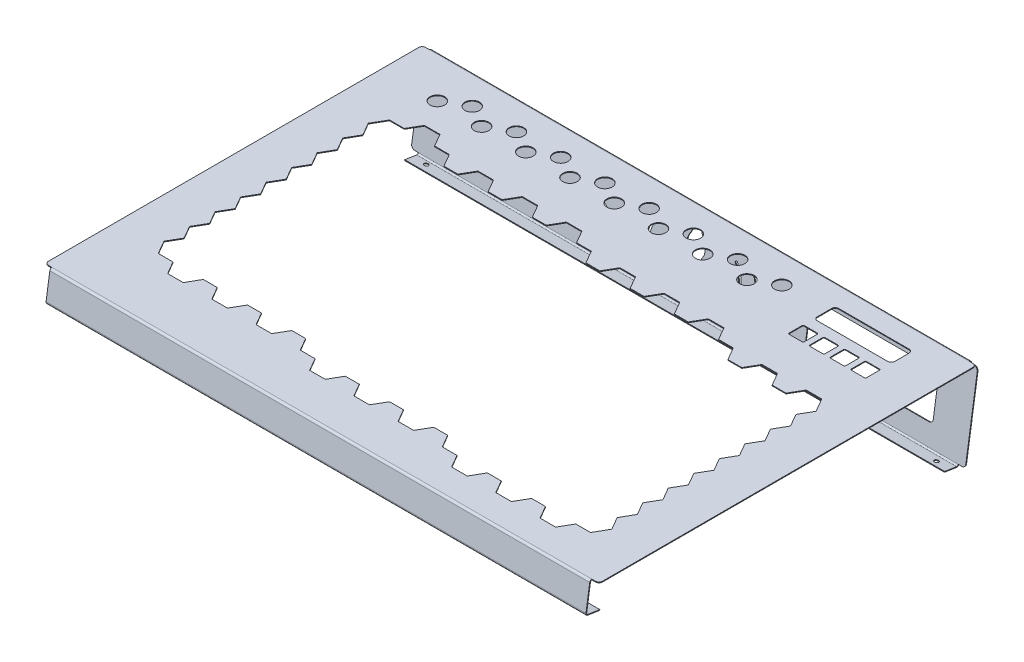
from build123d import *

# Parameters (mm, degrees)
SKETCH1_W                    = 481.838
SKETCH1_H                    = 340.0044
BASE_FLANGE1_DEPTH           = 0.6604
CUT_EXTRUDE1_DEPTH           = 388.714735506
EDGE_FLANGE1_START           = -330.2
EDGE_FLANGE1_DEPTH           = 481.838
EDGE_FLANGE1_2_DEPTH         = 481.838
EDGE_FLANGE2_STRIP_W         = 5.1816
EDGE_FLANGE2_STRIP_H         = 0.6604
EDGE_FLANGE2_STRIP_CUT_DEPTH = 481.838
EDGE_FLANGE2_DEPTH           = 481.838
EDGE_FLANGE3_STRIP_CUT_DEPTH = 481.838
EDGE_FLANGE3_DEPTH           = 481.838
CUT_EXTRUDE2_DEPTH           = 0.6604
EDGE_FLANGE4_STRIP_W         = 5.1816
EDGE_FLANGE4_STRIP_H         = 0.6604
EDGE_FLANGE4_STRIP_CUT_DEPTH = 481.838
EDGE_FLANGE4_DEPTH           = 481.838
SKETCH29_W                   = 6.35
SKETCH29_H                   = 336.766690974
TAB1_DEPTH                   = 0.6604
SKETCH31_W                   = 69.088
SKETCH31_H                   = 19.0754
CUT_EXTRUDE7_DEPTH           = 0.6604
CUT_EXTRUDE8_DEPTH           = 0.6604
SKETCH34_W                   = 6.35
SKETCH34_H                   = 73.450710069
TAB2_DEPTH                   = 0.6604
SKETCH35_W                   = 6.35
SKETCH35_H                   = 73.450710069
TAB3_DEPTH                   = 0.6604
SKETCH36_W                   = 6.35
SKETCH36_H                   = 336.766690974
TAB4_DEPTH                   = 0.6604
FILLET1_R                    = 3.175
FILLET2_R                    = 3.175
SKETCH37_R                   = 1.89865
CUT_EXTRUDE9_DEPTH           = 0.6604
SKETCH38_R                   = 1.89865
CUT_EXTRUDE10_DEPTH          = 0.6604
SKETCH39_R                   = 4.7625
CUT_EXTRUDE11_DEPTH          = 0.6604
CUT_EXTRUDE12_DEPTH          = 0.6604
SKETCH45_R                   = 6.5024
CUT_EXTRUDE13_DEPTH          = 0.6604
LPATTERN1_START              = -0.6604
LPATTERN1_OUTLINE_R          = 6.5024
LPATTERN1_DEPTH              = 0.6604
SKETCH46_W                   = 13.5128
SKETCH46_H                   = 13.5128
CUT_EXTRUDE14_DEPTH          = 0.6604
FILLET3_R                    = 1.00076
LPATTERN2_COUNT              = 4
LPATTERN2_PITCH              = 18.5166
FILLET3_OF_LPATTERN2_R       = 1.00076


# Read off the part's stored shape, not the designer's step: Edge-Flange1, LPattern1
# Sheet-metal steps are written as plain solids
with BuildPart() as part:
    # Sketch1 → Base-Flange1 (new body)
    with BuildSketch(Plane(origin=(0, 0, 0), x_dir=(1, 0, 0), z_dir=(0, 1, 0))):
        with Locations((-89.281, 33.1978)):
            Rectangle(SKETCH1_W, SKETCH1_H)
    extrude(amount=-BASE_FLANGE1_DEPTH)

    # Sketch4 → Cut-Extrude1 (cut, through all)
    with BuildSketch(Plane(origin=(0, 0, 0), x_dir=(1, 0, 0), z_dir=(0, 1, 0))):
        Polygon((114.842126805, 105.8291), (121.646745743, 94.0435), (115.069436274, 82.6516), (121.646745743, 71.2597), (115.069436274, 59.8678), (121.646745743, 48.4759), (115.069436274, 37.084), (121.646745743, 25.6921), (115.069436274, 14.3002), (121.646745743, 2.9083), (115.069436274, -8.4836), (121.646745743, -19.8755), (115.069436274, -31.2674), (121.646745743, -42.6593), (115.069436274, -54.0512), (121.646745743, -65.4431), (115.069436274, -76.835), (121.646745743, -88.2269), (114.842126805, -100.0125), (101.687446274, -100.0125), (95.110136805, -111.4044), (81.500938938, -111.4044), (74.923629469, -100.0125), (62.223466274, -100.0125), (55.646156805, -111.4044), (42.036958938, -111.4044), (35.459649469, -100.0125), (22.759486274, -100.0125), (16.182176805, -111.4044), (2.572978938, -111.4044), (-4.004330531, -100.0125), (-17.159011062, -100.0125), (-23.736320531, -88.6206), (-36.436483726, -88.6206), (-43.013793195, -100.0125), (-56.622991062, -100.0125), (-63.200300531, -88.6206), (-75.900463726, -88.6206), (-82.477773195, -100.0125), (-96.086971062, -100.0125), (-102.664280531, -88.6206), (-115.364443726, -88.6206), (-121.941753195, -100.0125), (-135.550951062, -100.0125), (-142.128260531, -88.6206), (-155.282941062, -88.6206), (-161.860250531, -77.2287), (-174.560413726, -77.2287), (-181.137723195, -88.6206), (-194.746921062, -88.6206), (-201.324230531, -77.2287), (-214.024393726, -77.2287), (-220.601703195, -88.6206), (-234.210901062, -88.6206), (-240.788210531, -77.2287), (-253.488373726, -77.2287), (-260.065683195, -88.6206), (-273.674881062, -88.6206), (-280.252190531, -77.2287), (-293.397981062, -77.2287), (-300.2026, -65.4431), (-293.625290531, -54.0512), (-300.2026, -42.6593), (-293.625290531, -31.2674), (-300.2026, -19.8755), (-293.625290531, -8.4836), (-300.2026, 2.9083), (-293.625290531, 14.3002), (-300.2026, 25.6921), (-293.625290531, 37.084), (-300.2026, 48.4759), (-293.625290531, 59.8678), (-300.2026, 71.2597), (-293.625290531, 82.6516), (-300.2026, 94.0435), (-293.625290531, 105.4354), (-300.2026, 116.8273), (-293.397981062, 128.6129), (-280.252190531, 128.6129), (-273.674881062, 140.0048), (-260.065683195, 140.0048), (-253.488373726, 128.6129), (-240.333693195, 128.6129), (-233.756383726, 117.221), (-221.056220531, 117.221), (-214.478911062, 128.6129), (-200.869713195, 128.6129), (-194.292403726, 117.221), (-181.592240531, 117.221), (-175.014931062, 128.6129), (-161.405733195, 128.6129), (-154.828423726, 117.221), (-142.128260531, 117.221), (-135.550951062, 128.6129), (-121.941753195, 128.6129), (-115.364443726, 117.221), (-102.209763195, 117.221), (-95.632453726, 105.8291), (-82.932290531, 105.8291), (-76.354981062, 117.221), (-62.745783195, 117.221), (-56.168473726, 105.8291), (-43.468310531, 105.8291), (-36.891001062, 117.221), (-23.281803195, 117.221), (-16.704493726, 105.8291), (-4.004330531, 105.8291), (2.572978938, 117.221), (16.182176805, 117.221), (22.759486274, 105.8291), (35.914166805, 105.8291), (42.491476274, 94.4372), (55.191639469, 94.4372), (61.768948938, 105.8291), (75.378146805, 105.8291), (81.955456274, 94.4372), (94.655619469, 94.4372), (101.232928938, 105.8291), align=None)
    extrude(amount=-CUT_EXTRUDE1_DEPTH, mode=Mode.SUBTRACT)

    # Edge-Flange1 outline → Edge-Flange1 (cut)
    with BuildSketch(Plane.YZ.offset(EDGE_FLANGE1_START)):
        with BuildLine():
            ThreePointArc((0, -201.052611381), (-0.17283746, -201.85099605), (-0.6604, -202.506414724))
            Line((-0.6604, -202.506414724), (-0.6604, -203.2))
            Line((-0.6604, -203.2), (0, -203.2))
            Line((0, -203.2), (0, -201.052611381))
        make_face()
    extrude(amount=EDGE_FLANGE1_DEPTH, mode=Mode.SUBTRACT)

    # Edge-Flange1 2 outline → Edge-Flange1 2 (add)
    with BuildSketch(Plane.YZ.offset(EDGE_FLANGE1_START)):
        with BuildLine():
            Line((-76.082292801, -191.65007176), (-2.222610363, -202.960766842))
            ThreePointArc((-2.222610363, -202.960766842), (-1.391301581, -202.906207091), (-0.6604, -202.506414724))
            Line((-0.6604, -202.506414724), (-0.6604, -201.052611381))
            ThreePointArc((-0.6604, -201.052611381), (-1.103130228, -202.016211258), (-2.12264366, -202.307976816))
            Line((-2.12264366, -202.307976816), (-75.982326098, -190.997281734))
            Line((-75.982326098, -190.997281734), (-76.082292801, -191.65007176))
        make_face()
    extrude(amount=EDGE_FLANGE1_2_DEPTH)

    # Edge-Flange2 strip (across the edge) → Edge-Flange2 strip cut (cut)
    with BuildSketch(Plane(origin=(-330.2, -75.982326098, -190.997281734), x_dir=(0, 0.988476720451994, -0.15137296034784634), z_dir=(1, 0, 0))):
        with Locations((-1.3208, -0.3302)):
            Rectangle(EDGE_FLANGE2_STRIP_W, EDGE_FLANGE2_STRIP_H)
    extrude(amount=EDGE_FLANGE2_STRIP_CUT_DEPTH, mode=Mode.SUBTRACT)

    # Edge-Flange2 section (across the edge) → Edge-Flange2 (add)
    with BuildSketch(Plane(origin=(-330.2, -75.982326098, -190.997281734), x_dir=(0, 0.988476720451994, -0.15137296034784634), z_dir=(1, 0, 0))):
        with BuildLine():
            Line((-0.6604, 1.27), (-0.6604, 12.0396))
            Line((-0.6604, 12.0396), (0, 12.0396))
            Line((0, 12.0396), (0, 1.27))
            ThreePointArc((0, 1.27), (0.371974388, 0.371974388), (1.27, 0))
            Line((1.27, 0), (1.27, -0.6604))
            ThreePointArc((1.27, -0.6604), (-0.09499893, -0.09499893), (-0.6604, 1.27))
        make_face()
    extrude(amount=EDGE_FLANGE2_DEPTH)

    # Edge-Flange3 strip (across the edge) → Edge-Flange3 strip cut (cut)
    with BuildSketch(Plane(origin=(151.638, -0.6604, 136.8044), x_dir=(0, -0.15137296034785702, -0.9884767204519923), z_dir=(-1, 0, 0))):
        Polygon((-4.144101337, -0.033480923), (0.977789637, -0.817835054), (1.07775634, -0.165045028), (-4.044134634, 0.619309104), align=None)
    extrude(amount=EDGE_FLANGE3_STRIP_CUT_DEPTH, mode=Mode.SUBTRACT)

    # Edge-Flange3 section (across the edge) → Edge-Flange3 (add)
    with BuildSketch(Plane(origin=(151.638, -0.6604, 136.8044), x_dir=(0, -0.15137296034785702, -0.9884767204519923), z_dir=(-1, 0, 0))):
        with BuildLine():
            Line((-0.6604, 1.090320407), (-0.6604, 24.833033388))
            Line((-0.6604, 24.833033388), (0, 24.833033388))
            Line((0, 24.833033388), (0, 1.090320407))
            ThreePointArc((0, 1.090320407), (0.306400123, 0.263050635), (1.07775634, -0.165045028))
            Line((1.07775634, -0.165045028), (0.977789637, -0.817835054))
            ThreePointArc((0.977789637, -0.817835054), (-0.194671814, -0.167129647), (-0.6604, 1.090320407))
        make_face()
    extrude(amount=EDGE_FLANGE3_DEPTH)

    # Sketch20 → Cut-Extrude2 (cut)
    with BuildSketch(Plane(origin=(0, 0, 0), x_dir=(1, 0, 0), z_dir=(0, 1, 0))):
        Polygon((-194.145758908, 117.475), (-200.723068378, 128.8669), (-214.625555879, 128.8669), (-221.202865348, 117.475), (-233.609738908, 117.475), (-240.187048378, 128.8669), (-253.341728908, 128.8669), (-259.919038378, 140.2588), (-273.821525879, 140.2588), (-280.398835348, 128.8669), (-293.544625879, 128.8669), (-300.495896088, 116.8273), (-293.918586619, 105.4354), (-300.495896088, 94.0435), (-293.918586619, 82.6516), (-300.495896088, 71.2597), (-293.918586619, 59.8678), (-300.495896088, 48.4759), (-293.918586619, 37.084), (-300.495896088, 25.6921), (-293.918586619, 14.3002), (-300.495896088, 2.9083), (-293.918586619, -8.4836), (-300.495896088, -19.8755), (-293.918586619, -31.2674), (-300.495896088, -42.6593), (-293.918586619, -54.0512), (-300.495896088, -65.4431), (-293.544625879, -77.4827), (-280.398835348, -77.4827), (-273.821525879, -88.8746), (-259.919038378, -88.8746), (-253.341728908, -77.4827), (-240.934855348, -77.4827), (-234.357545879, -88.8746), (-220.455058378, -88.8746), (-213.877748908, -77.4827), (-201.470875348, -77.4827), (-194.893565879, -88.8746), (-180.991078378, -88.8746), (-174.413768908, -77.4827), (-162.006895348, -77.4827), (-155.429585879, -88.8746), (-142.274905348, -88.8746), (-135.697595879, -100.2665), (-121.795108378, -100.2665), (-115.217798908, -88.8746), (-102.810925348, -88.8746), (-96.233615879, -100.2665), (-82.331128378, -100.2665), (-75.753818908, -88.8746), (-63.346945348, -88.8746), (-56.769635879, -100.2665), (-42.867148378, -100.2665), (-36.289838908, -88.8746), (-23.882965348, -88.8746), (-17.305655879, -100.2665), (-4.150975348, -100.2665), (2.426334121, -111.6584), (16.328821622, -111.6584), (22.906131092, -100.2665), (35.313004652, -100.2665), (41.890314121, -111.6584), (55.792801622, -111.6584), (62.370111092, -100.2665), (74.776984652, -100.2665), (81.354294121, -111.6584), (95.256781622, -111.6584), (101.834091092, -100.2665), (114.988771622, -100.2665), (121.940041831, -88.2269), (115.362732362, -76.835), (121.940041831, -65.4431), (115.362732362, -54.0512), (121.940041831, -42.6593), (115.362732362, -31.2674), (121.940041831, -19.8755), (115.362732362, -8.4836), (121.940041831, 2.9083), (115.362732362, 14.3002), (121.940041831, 25.6921), (115.362732362, 37.084), (121.940041831, 48.4759), (115.362732362, 59.8678), (121.940041831, 71.2597), (115.362732362, 82.6516), (121.940041831, 94.0435), (114.988771622, 106.0831), (101.086284121, 106.0831), (94.508974652, 94.6912), (82.102101092, 94.6912), (75.524791622, 106.0831), (61.622304121, 106.0831), (55.044994652, 94.6912), (42.638121092, 94.6912), (36.060811622, 106.0831), (22.906131092, 106.0831), (16.328821622, 117.475), (2.426334121, 117.475), (-4.150975348, 106.0831), (-16.557848908, 106.0831), (-23.135158378, 117.475), (-37.037645879, 117.475), (-43.614955348, 106.0831), (-56.021828908, 106.0831), (-62.599138378, 117.475), (-76.501625879, 117.475), (-83.078935348, 106.0831), (-95.485808908, 106.0831), (-102.063118378, 117.475), (-115.217798908, 117.475), (-121.795108378, 128.8669), (-135.697595879, 128.8669), (-142.274905348, 117.475), (-154.681778908, 117.475), (-161.259088378, 128.8669), (-175.161575879, 128.8669), (-181.738885348, 117.475), align=None)
    extrude(amount=-CUT_EXTRUDE2_DEPTH, mode=Mode.SUBTRACT)

    # Edge-Flange4 strip (across the edge) → Edge-Flange4 strip cut (cut)
    with BuildSketch(Plane(origin=(151.638, -25.207275402, 140.563449778), x_dir=(0, 0.9884767204519918, -0.15137296034786094), z_dir=(-1, 0, 0))):
        with Locations((-1.3208, -0.3302)):
            Rectangle(EDGE_FLANGE4_STRIP_W, EDGE_FLANGE4_STRIP_H)
    extrude(amount=EDGE_FLANGE4_STRIP_CUT_DEPTH, mode=Mode.SUBTRACT)

    # Edge-Flange4 section (across the edge) → Edge-Flange4 (add)
    with BuildSketch(Plane(origin=(151.638, -25.207275402, 140.563449778), x_dir=(0, 0.9884767204519918, -0.15137296034786094), z_dir=(-1, 0, 0))):
        with BuildLine():
            Line((-0.6604, 1.27), (-0.6604, 12.0396))
            Line((-0.6604, 12.0396), (0, 12.0396))
            Line((0, 12.0396), (0, 1.27))
            ThreePointArc((0, 1.27), (0.371974388, 0.371974388), (1.27, 0))
            Line((1.27, 0), (1.27, -0.6604))
            ThreePointArc((1.27, -0.6604), (-0.09499893, -0.09499893), (-0.6604, 1.27))
        make_face()
    extrude(amount=EDGE_FLANGE4_DEPTH)

    # Sketch29 → Tab1 (add)
    with BuildSketch(Plane(origin=(0, 0, 0), x_dir=(1, 0, 0), z_dir=(0, 1, 0))):
        with Locations((154.813, 32.669265894)):
            Rectangle(SKETCH29_W, SKETCH29_H)
    extrude(amount=-TAB1_DEPTH)

    # Sketch31 → Cut-Extrude7 (cut)
    with BuildSketch(Plane(origin=(0, 0, 0), x_dir=(1, 0, 0), z_dir=(0, 1, 0))):
        with Locations((83.9851, 174.090511381)):
            Rectangle(SKETCH31_W, SKETCH31_H)
    extrude(amount=-CUT_EXTRUDE7_DEPTH, mode=Mode.SUBTRACT)

    # Sketch32 → Cut-Extrude8 (cut)
    with BuildSketch(Plane(origin=(0, -30.419673409, -198.64273606), x_dir=(-1, 0, 0), z_dir=(0, -0.15137296034784972, -0.9884767204519934))):
        with BuildLine():
            Line((-123.063, 10.642185543), (-15.113, 10.642185543))
            ThreePointArc((-15.113, 10.642185543), (-12.86793597, 9.712249573), (-11.938, 7.467185543))
            Line((-11.938, 7.467185543), (-11.938, -24.282814457))
            ThreePointArc((-11.938, -24.282814457), (-12.86793597, -26.527878488), (-15.113, -27.457814457))
            Line((-15.113, -27.457814457), (-123.063, -27.457814457))
            ThreePointArc((-123.063, -27.457814457), (-125.30806403, -26.527878488), (-126.238, -24.282814457))
            Line((-126.238, -24.282814457), (-126.238, 7.467185543))
            ThreePointArc((-126.238, 7.467185543), (-125.30806403, 9.712249573), (-123.063, 10.642185543))
        make_face()
    extrude(amount=-CUT_EXTRUDE8_DEPTH, mode=Mode.SUBTRACT)

    # Sketch34 → Tab2 (add)
    with BuildSketch(Plane(origin=(0, -30.419673409, -198.64273606), x_dir=(-1, 0, 0), z_dir=(0, -0.15137296034784972, -0.9884767204519934))):
        with Locations((-154.813, -8.199581526)):
            Rectangle(SKETCH34_W, SKETCH34_H)
    extrude(amount=-TAB2_DEPTH)

    # Sketch35 → Tab3 (add)
    with BuildSketch(Plane(origin=(0, -30.419673409, -198.64273606), x_dir=(-1, 0, 0), z_dir=(0, -0.15137296034784972, -0.9884767204519934))):
        with Locations((333.375, -8.199581526)):
            Rectangle(SKETCH35_W, SKETCH35_H)
    extrude(amount=-TAB3_DEPTH)

    # Sketch36 → Tab4 (add)
    with BuildSketch(Plane(origin=(0, 0, 0), x_dir=(1, 0, 0), z_dir=(0, 1, 0))):
        with Locations((-333.375, 32.669265894)):
            Rectangle(SKETCH36_W, SKETCH36_H)
    extrude(amount=-TAB4_DEPTH)

    # Fillet1
    fillet1_edges = [part.edges().sort_by_distance(p)[0] for p in [
        (157.988, -0.3302, -201.052611381),
        (157.988, -0.3302, 135.714079593),
        (157.988, -2.172627011, -202.634371829),
        (157.988, -74.776944015, -191.515920406),
        (-336.55, -2.172627011, -202.634371829),
        (-336.55, -74.776944015, -191.515920406),
        (-336.55, -0.3302, -201.052611381),
        (-336.55, -0.3302, 135.714079593),
    ]]
    fillet(fillet1_edges, radius=FILLET1_R)

    # Fillet2
    fillet2_edges = [part.edges().sort_by_distance(p)[0] for p in [
        (49.4411, -0.3302, -164.552811381),
        (49.4411, -0.3302, -183.628211381),
        (118.5291, -0.3302, -183.628211381),
        (118.5291, -0.3302, -164.552811381),
    ]]
    fillet(fillet2_edges, radius=FILLET2_R)

    # Sketch37 → Cut-Extrude9 (cut)
    with BuildSketch(Plane(origin=(0, -46.314790505, 7.092536224), x_dir=(1, 0, 0), z_dir=(0, -0.9884767204519918, 0.15137296034786102))):
        with Locations(Location((139.319, 128.168397952, 0), (0, 0, 270))):
            Circle(SKETCH37_R)
        with Locations(Location((-13.081, 129.050688068, 0), (0, 0, 270))):
            Circle(SKETCH37_R)
        with Locations(Location((-165.481, 129.932978183, 0), (0, 0, 270))):
            Circle(SKETCH37_R)
        with Locations(Location((-317.881, 130.815268299, 0), (0, 0, 270))):
            Circle(SKETCH37_R)
    extrude(amount=-CUT_EXTRUDE9_DEPTH, mode=Mode.SUBTRACT)

    # Sketch38 → Cut-Extrude10 (cut)
    with BuildSketch(Plane(origin=(0, -46.315409418, 7.092631003), x_dir=(1, 0, 0), z_dir=(0, -0.9884767204519939, 0.1513729603478471))):
        with Locations(Location((139.319, -193.338436299, 0), (0, 0, 270))):
            Circle(SKETCH38_R)
        with Locations(Location((-13.081, -193.969655828, 0), (0, 0, 270))):
            Circle(SKETCH38_R)
        with Locations(Location((-165.481, -194.600875358, 0), (0, 0, 270))):
            Circle(SKETCH38_R)
        with Locations(Location((-317.881, -195.232094888, 0), (0, 0, 270))):
            Circle(SKETCH38_R)
    extrude(amount=-CUT_EXTRUDE10_DEPTH, mode=Mode.SUBTRACT)

    # Sketch39 → Cut-Extrude11 (cut)
    with BuildSketch(Plane(origin=(0, -30.419673409, -198.64273606), x_dir=(-1, 0, 0), z_dir=(0, -0.15137296034784972, -0.9884767204519934))):
        with Locations(Location((304.8, -10.63493656, 0), (0, 0, 90))):
            Circle(SKETCH39_R)
        with Locations(Location((260.35, -10.63493656, 0), (0, 0, 90))):
            Circle(SKETCH39_R)
        with Locations(Location((215.9, -10.63493656, 0), (0, 0, 90))):
            Circle(SKETCH39_R)
        with Locations(Location((171.45, -10.63493656, 0), (0, 0, 90))):
            Circle(SKETCH39_R)
    extrude(amount=-CUT_EXTRUDE11_DEPTH, mode=Mode.SUBTRACT)

    # Sketch40 → Cut-Extrude12 (cut)
    with BuildSketch(Plane(origin=(0, -30.419673409, -198.64273606), x_dir=(-1, 0, 0), z_dir=(0, -0.15137296034784972, -0.9884767204519934))):
        with BuildLine():
            Line((81.548841842, -18.995804072), (82.907028371, -18.995804072))
            add(Edge.make_bspline(
                [(82.907028371, -18.995804072), (82.212290018, -16.919788278), (80.533395781, -14.894918186), (78.122800006, -13.627444365)],
                knots=[0, 0, 0, 0, 1, 1, 1, 1], degree=3))
            add(Edge.make_bspline(
                [(78.122800006, -13.627444365), (70.71065095, -9.730426621), (67.501562844, -16.607396179), (69.564631552, -20.427883732)],
                knots=[0, 0, 0, 0, 1, 1, 1, 1], degree=3))
            add(Edge.make_bspline(
                [(69.564631552, -20.427883732), (56.880170562, -17.295192856), (61.283598345, -4.328665978), (69.487863138, -3.388520219)],
                knots=[0, 0, 0, 0, 1, 1, 1, 1], degree=3))
            add(Edge.make_bspline(
                [(69.487863138, -3.388520219), (76.8232327, -2.547973401), (84.540422213, -7.667524115), (85.992218895, -17.90630976)],
                knots=[0, 0, 0, 0, 1, 1, 1, 1], degree=3))
            add(Edge.make_bspline(
                [(85.992218895, -17.90630976), (86.042877073, -18.263199505), (86.085408004, -18.627656953), (86.119180123, -18.995804072)],
                knots=[0, 0, 0, 0, 1, 1, 1, 1], degree=3))
            Line((86.119180123, -18.995804072), (87.389180123, -18.995804072))
            add(Edge.make_bspline(
                [(87.389180123, -18.995804072), (86.764645229, -12.051384457), (83.889871183, -7.232536345), (82.168778418, -4.027625433)],
                knots=[0, 0, 0, 0, 1, 1, 1, 1], degree=3))
            add(Edge.make_bspline(
                [(82.168778418, -4.027625433), (79.937735524, 0.126516912), (81.74856595, 4.218898829), (82.630236526, 6.050100002)],
                knots=[0, 0, 0, 0, 1, 1, 1, 1], degree=3))
            add(Edge.make_bspline(
                [(82.630236526, 6.050100002), (83.630403141, 8.127179485), (88.161484658, 16.522769758), (89.315376462, 19.369073509)],
                knots=[0, 0, 0, 0, 1, 1, 1, 1], degree=3))
            add(Edge.make_bspline(
                [(89.315376462, 19.369073509), (90.469212865, 16.522769758), (94.966405922, 8.127179485), (95.966611317, 6.050100002)],
                knots=[0, 0, 0, 0, 1, 1, 1, 1], degree=3))
            add(Edge.make_bspline(
                [(95.966611317, 6.050100002), (96.848531196, 4.218898829), (98.659250821, 0.126516912), (96.428207927, -4.027625433)],
                knots=[0, 0, 0, 0, 1, 1, 1, 1], degree=3))
            add(Edge.make_bspline(
                [(96.428207927, -4.027625433), (94.718666157, -7.210697485), (91.829072488, -12.082790976), (91.158366852, -18.995804072)],
                knots=[0, 0, 0, 0, 1, 1, 1, 1], degree=3))
            Line((91.158366852, -18.995804072), (92.428366852, -18.995804072))
            add(Edge.make_bspline(
                [(92.428366852, -18.995804072), (92.461823188, -18.627501832), (92.504664361, -18.263199505), (92.55532254, -17.90630976)],
                knots=[0, 0, 0, 0, 1, 1, 1, 1], degree=3))
            add(Edge.make_bspline(
                [(92.55532254, -17.90630976), (94.007257723, -7.667352374), (101.724452776, -2.547973401), (109.059805718, -3.388520219)],
                knots=[0, 0, 0, 0, 1, 1, 1, 1], degree=3))
            add(Edge.make_bspline(
                [(109.059805718, -3.388520219), (117.264020651, -4.328494237), (121.667293313, -17.295037735), (108.983347547, -20.427883732)],
                knots=[0, 0, 0, 0, 1, 1, 1, 1], degree=3))
            add(Edge.make_bspline(
                [(108.983347547, -20.427883732), (111.046388554, -16.607396179), (107.837350308, -9.730426621), (100.425151392, -13.627444365)],
                knots=[0, 0, 0, 0, 1, 1, 1, 1], degree=3))
            add(Edge.make_bspline(
                [(100.425151392, -13.627444365), (98.014599937, -14.894918186), (96.335533959, -16.919788278), (95.640967346, -18.995804072)],
                knots=[0, 0, 0, 0, 1, 1, 1, 1], degree=3))
            Line((95.640967346, -18.995804072), (96.882768596, -18.995804072))
            add(Edge.make_bspline(
                [(96.882768596, -18.995804072), (98.054161404, -18.995804072), (99.003841582, -19.683894371), (99.003841582, -20.532906378)],
                knots=[0, 0, 0, 0, 1, 1, 1, 1], degree=3))
            add(Edge.make_bspline(
                [(99.003841582, -20.532906378), (99.003841582, -21.381885145), (98.054161404, -22.069992065), (96.882768596, -22.069992063)],
                knots=[0, 0, 0, 0, 1, 1, 1, 1], degree=3))
            Line((96.882768596, -22.069992063), (95.371216981, -22.069992063))
            add(Edge.make_bspline(
                [(95.371216981, -22.069992063), (95.4947323, -22.73946227), (95.749352801, -23.37320472), (96.146313697, -23.94261062)],
                knots=[0, 0, 0, 0, 1, 1, 1, 1], degree=3))
            add(Edge.make_bspline(
                [(96.146313697, -23.94261062), (97.904031705, -26.464195672), (103.790806731, -25.08876298), (100.505216133, -19.587347994)],
                knots=[0, 0, 0, 0, 1, 1, 1, 1], degree=3))
            add(Edge.make_bspline(
                [(100.505216133, -19.587347994), (106.058181244, -18.856466382), (107.533849984, -24.095471562), (105.929314241, -26.922717556)],
                knots=[0, 0, 0, 0, 1, 1, 1, 1], degree=3))
            add(Edge.make_bspline(
                [(105.929314241, -26.922717556), (104.165895526, -30.527309526), (96.463320654, -31.607723703), (93.548486537, -26.464195672)],
                knots=[0, 0, 0, 0, 1, 1, 1, 1], degree=3))
            add(Edge.make_bspline(
                [(93.548486537, -26.464195672), (92.849471267, -25.23056045), (92.498564771, -23.685452778), (92.385226517, -22.069992063)],
                knots=[0, 0, 0, 0, 1, 1, 1, 1], degree=3))
            Line((92.385226517, -22.069992063), (91.014242563, -22.069992063))
            add(Edge.make_bspline(
                [(91.014242563, -22.069992063), (91.022059568, -23.291306225), (91.095858517, -24.568015302), (91.259057184, -25.901875491)],
                knots=[0, 0, 0, 0, 1, 1, 1, 1], degree=3))
            add(Edge.make_bspline(
                [(91.259057184, -25.901875491), (93.206333395, -27.156119682), (92.447275111, -29.862797662), (94.913576046, -31.480873276)],
                knots=[0, 0, 0, 0, 1, 1, 1, 1], degree=3))
            add(Edge.make_bspline(
                [(94.913576046, -31.480873276), (93.364341039, -31.521681253), (92.100340827, -31.217903926), (91.692482661, -30.647107475)],
                knots=[0, 0, 0, 0, 1, 1, 1, 1], degree=3))
            add(Edge.make_bspline(
                [(91.692482661, -30.647107475), (91.692482661, -32.302301396), (90.21174478, -33.697606232), (89.246491533, -35.706310471)],
                knots=[0, 0, 0, 0, 1, 1, 1, 1], degree=3))
            add(Edge.make_bspline(
                [(89.246491533, -35.706310471), (88.349779732, -33.686348859), (86.904908107, -31.996507492), (86.904908107, -30.647107475)],
                knots=[0, 0, 0, 0, 1, 1, 1, 1], degree=3))
            add(Edge.make_bspline(
                [(86.904908107, -30.647107475), (86.497188442, -31.217903926), (85.23325471, -31.521681253), (83.683831342, -31.480873276)],
                knots=[0, 0, 0, 0, 1, 1, 1, 1], degree=3))
            add(Edge.make_bspline(
                [(83.683831342, -31.480873276), (85.945189366, -30.093573806), (85.05386803, -27.552127691), (87.265349022, -25.736815368)],
                knots=[0, 0, 0, 0, 1, 1, 1, 1], degree=3))
            add(Edge.make_bspline(
                [(87.265349022, -25.736815368), (87.421700192, -24.45994563), (87.497548958, -23.239412616), (87.510025142, -22.069992063)],
                knots=[0, 0, 0, 0, 1, 1, 1, 1], degree=3))
            Line((87.510025142, -22.069992063), (86.162719343, -22.069992063))
            add(Edge.make_bspline(
                [(86.162719343, -22.069992063), (86.049364467, -23.685452778), (85.69835271, -25.23056045), (84.999492562, -26.464195672)],
                knots=[0, 0, 0, 0, 1, 1, 1, 1], degree=3))
            add(Edge.make_bspline(
                [(84.999492562, -26.464195672), (82.084658445, -31.607596282), (74.382083572, -30.527309526), (72.618648238, -26.922717556)],
                knots=[0, 0, 0, 0, 1, 1, 1, 1], degree=3))
            add(Edge.make_bspline(
                [(72.618648238, -26.922717556), (71.013957374, -24.095643303), (72.489659353, -18.856466382), (78.042746345, -19.587347994)],
                knots=[0, 0, 0, 0, 1, 1, 1, 1], degree=3))
            add(Edge.make_bspline(
                [(78.042746345, -19.587347994), (74.757000626, -25.08876298), (80.643936314, -26.464195672), (82.401698641, -23.94261062)],
                knots=[0, 0, 0, 0, 1, 1, 1, 1], degree=3))
            add(Edge.make_bspline(
                [(82.401698641, -23.94261062), (82.798471176, -23.37320472), (83.052980877, -22.73946227), (83.176612536, -22.069992063)],
                knots=[0, 0, 0, 0, 1, 1, 1, 1], degree=3))
            Line((83.176612536, -22.069992063), (81.548841842, -22.069992063))
            add(Edge.make_bspline(
                [(81.548841842, -22.069992063), (80.377415794, -22.069992065), (79.427718996, -21.381741104), (79.427718996, -20.532906378)],
                knots=[0, 0, 0, 0, 1, 1, 1, 1], degree=3))
            add(Edge.make_bspline(
                [(79.427718996, -20.532906378), (79.427718996, -19.68373925), (80.377415794, -18.995804072), (81.548841842, -18.995804072)],
                knots=[0, 0, 0, 0, 1, 1, 1, 1], degree=3))
        make_face()
        with BuildLine():
            ThreePointArc((53.32515243, -29.058296969), (54.875374641, -29.286725577), (55.103803248, -27.736503367))
            add(Edge.make_bspline(
                [(49.665767325, -11.807637049), (49.772827635, -17.417131577), (51.757285621, -23.233314437), (55.103803248, -27.736503367)],
                knots=[0, 0, 0, 0, 0.989781357, 0.989781357, 0.989781357, 0.989781357], degree=3))
            add(Edge.make_bspline(
                [(54.878701227, 4.675025511), (51.506581459, 0.002266162), (49.593820503, -6.045632597), (49.665767325, -11.807637049)],
                knots=[0, 0, 0, 0, 1, 1, 1, 1], degree=3))
            ThreePointArc((54.878701227, 4.675025511), (54.156383777, 6.065574335), (52.765834953, 5.343256884))
            add(Edge.make_bspline(
                [(47.444914173, -11.480847039), (47.371477184, -5.59948161), (49.323860927, 0.573700604), (52.765834953, 5.343256884)],
                knots=[0, 0, 0, 0, 1, 1, 1, 1], degree=3))
            add(Edge.make_bspline(
                [(53.32515243, -29.058296969), (49.639959737, -24.099375252), (47.522045807, -17.658678413), (47.444914173, -11.480847039)],
                knots=[0, 0, 0, 0, 1.009909674, 1.009909674, 1.009909674, 1.009909674], degree=3))
        make_face()
        with BuildLine():
            ThreePointArc((40.295163736, -34.224632569), (41.845385742, -34.453062569), (42.073815741, -32.902840563))
            add(Edge.make_bspline(
                [(34.910520595, -11.867889214), (35.040189598, -19.27382264), (37.655709631, -26.957674262), (42.073815741, -32.902840563)],
                knots=[0, 0, 0, 0, 0.992225282, 0.992225282, 0.992225282, 0.992225282], degree=3))
            add(Edge.make_bspline(
                [(41.776327199, 9.840948194), (37.335002649, 3.686594285), (34.815768369, -4.278919733), (34.910520595, -11.867889214)],
                knots=[0, 0, 0, 0, 1, 1, 1, 1], degree=3))
            ThreePointArc((41.776327199, 9.840948194), (41.054009886, 11.231497089), (39.663460991, 10.509179776))
            add(Edge.make_bspline(
                [(32.6898, -11.540679959), (32.593559277, -3.832495986), (35.152368077, 4.258147608), (39.663460991, 10.509179776)],
                knots=[0, 0, 0, 0, 1, 1, 1, 1], degree=3))
            add(Edge.make_bspline(
                [(40.295163736, -34.224632569), (35.538312428, -27.823638252), (32.789368831, -19.515041919), (32.6898, -11.540679959)],
                knots=[0, 0, 0, 0, 1.007594664, 1.007594664, 1.007594664, 1.007594664], degree=3))
        make_face()
        with BuildLine():
            ThreePointArc((136.485301257, -32.902840563), (136.713731257, -34.453062569), (138.263953262, -34.224632569))
            add(Edge.make_bspline(
                [(145.869316999, -11.540679959), (145.769748168, -19.515041919), (143.020804572, -27.823638252), (138.263953262, -34.224632569)],
                knots=[0, 0, 0, 0, 1.007594664, 1.007594664, 1.007594664, 1.007594664], degree=3))
            add(Edge.make_bspline(
                [(138.584628012, 11.492612109), (143.296917427, 4.962781471), (145.969850096, -3.488707979), (145.869316999, -11.540679959)],
                knots=[0, 0, 0, 0, 1, 1, 1, 1], degree=3))
            ThreePointArc((138.584628012, 11.492612109), (137.194079117, 12.214929422), (136.471761804, 10.824380527))
            add(Edge.make_bspline(
                [(143.648596405, -11.867889214), (143.747641002, -3.935131726), (141.114282856, 4.39122815), (136.471761804, 10.824380527)],
                knots=[0, 0, 0, 0, 1, 1, 1, 1], degree=3))
            add(Edge.make_bspline(
                [(136.485301257, -32.902840563), (140.903407368, -26.957674262), (143.518927401, -19.27382264), (143.648596405, -11.867889214)],
                knots=[0, 0, 0, 0, 0.992225282, 0.992225282, 0.992225282, 0.992225282], degree=3))
        make_face()
        with BuildLine():
            ThreePointArc((123.455314241, -27.736502707), (123.683741698, -29.286725087), (125.233964078, -29.058297629))
            add(Edge.make_bspline(
                [(131.114202826, -11.480847039), (131.037071189, -17.658678674), (128.919160607, -24.099378438), (125.233964078, -29.058297629)],
                knots=[0, 0, 0, 0, 1.009909674, 1.009909674, 1.009909674, 1.009909674], degree=3))
            add(Edge.make_bspline(
                [(125.482386421, 6.326271009), (129.125471254, 1.278034735), (131.191930658, -5.255839813), (131.114202826, -11.480847039)],
                knots=[0, 0, 0, 0, 1, 1, 1, 1], degree=3))
            ThreePointArc((125.482386421, 6.326271009), (124.091837598, 7.04858846), (123.369520147, 5.658039636))
            add(Edge.make_bspline(
                [(128.893349676, -11.807637054), (128.969587355, -5.701990803), (126.942750712, 0.706600284), (123.369520147, 5.658039636)],
                knots=[0, 0, 0, 0, 1, 1, 1, 1], degree=3))
            add(Edge.make_bspline(
                [(123.455314241, -27.736502707), (126.801835054, -23.233316472), (128.786289479, -17.417131321), (128.893349676, -11.807637054)],
                knots=[0, 0, 0, 0, 0.989781358, 0.989781358, 0.989781358, 0.989781358], degree=3))
        make_face()
    extrude(amount=-CUT_EXTRUDE12_DEPTH, mode=Mode.SUBTRACT)

    # Sketch45 → Cut-Extrude13 (cut)
    with BuildSketch(Plane(origin=(0, 0, 0), x_dir=(1, 0, 0), z_dir=(0, 1, 0))):
        with Locations(Location((-286.9692, 164.960299911, 0), (0, 0, 270))):
            Circle(SKETCH45_R)
    extrude(amount=-CUT_EXTRUDE13_DEPTH, mode=Mode.SUBTRACT)

    # LPattern1 outline → LPattern1 (cut)
    with BuildSketch(Plane(origin=(0, 0, 0), x_dir=(1, 0, 0), z_dir=(0, 1, 0)).offset(LPATTERN1_START)):
        with Locations((-247.4976, 164.960299911)):
            Circle(LPATTERN1_OUTLINE_R)
        with Locations((-208.026, 164.960299911)):
            Circle(LPATTERN1_OUTLINE_R)
        with Locations((-168.5544, 164.960299911)):
            Circle(LPATTERN1_OUTLINE_R)
        with Locations((-129.0828, 164.960299911)):
            Circle(LPATTERN1_OUTLINE_R)
        with Locations((-89.6112, 164.960299911)):
            Circle(LPATTERN1_OUTLINE_R)
        with Locations((-50.1396, 164.960299911)):
            Circle(LPATTERN1_OUTLINE_R)
        with Locations((-10.668, 164.960299911)):
            Circle(LPATTERN1_OUTLINE_R)
        with Locations((-267.2334, 176.364899911)):
            Circle(LPATTERN1_OUTLINE_R)
        with Locations((-227.7618, 176.364899911)):
            Circle(LPATTERN1_OUTLINE_R)
        with Locations((-188.2902, 176.364899911)):
            Circle(LPATTERN1_OUTLINE_R)
        with Locations((-148.8186, 176.364899911)):
            Circle(LPATTERN1_OUTLINE_R)
        with Locations((-109.347, 176.364899911)):
            Circle(LPATTERN1_OUTLINE_R)
        with Locations((-69.8754, 176.364899911)):
            Circle(LPATTERN1_OUTLINE_R)
        with Locations((-30.4038, 176.364899911)):
            Circle(LPATTERN1_OUTLINE_R)
        with Locations((9.0678, 176.364899911)):
            Circle(LPATTERN1_OUTLINE_R)
    extrude(amount=LPATTERN1_DEPTH, mode=Mode.SUBTRACT)

    # Sketch46 → Cut-Extrude14 (cut)
    with BuildSketch(Plane(origin=(0, 0, 0), x_dir=(1, 0, 0), z_dir=(0, 1, 0))):
        with Locations((56.1975, 148.271411381)):
            Rectangle(SKETCH46_W, SKETCH46_H)
    cut_extrude14 = extrude(amount=-CUT_EXTRUDE14_DEPTH, mode=Mode.SUBTRACT)

    # Fillet3
    fillet3_edges = [part.edges().sort_by_distance(p)[0] for p in [
        (49.4411, -0.3302, -141.515011381),
        (49.4411, -0.3302, -155.027811381),
        (62.9539, -0.3302, -155.027811381),
        (62.9539, -0.3302, -141.515011381),
    ]]
    fillet(fillet3_edges, radius=FILLET3_R)

    # LPattern2: Cut-Extrude14 ×4
    with Locations(*[(i * LPATTERN2_PITCH, 0, 0) for i in range(1, LPATTERN2_COUNT)]):
        add(cut_extrude14, mode=Mode.SUBTRACT)

    # Fillet3 of LPattern2
    fillet3_of_lpattern2_edges = [part.edges().sort_by_distance(p)[0] for p in [
        (67.9577, -0.3302, -141.515011381),
        (67.9577, -0.3302, -155.027811381),
        (81.4705, -0.3302, -155.027811381),
        (81.4705, -0.3302, -141.515011381),
        (86.4743, -0.3302, -141.515011381),
        (86.4743, -0.3302, -155.027811381),
        (99.9871, -0.3302, -155.027811381),
        (99.9871, -0.3302, -141.515011381),
        (104.9909, -0.3302, -141.515011381),
        (104.9909, -0.3302, -155.027811381),
        (118.5037, -0.3302, -155.027811381),
        (118.5037, -0.3302, -141.515011381),
    ]]
    fillet(fillet3_of_lpattern2_edges, radius=FILLET3_OF_LPATTERN2_R)


solid = part.part
